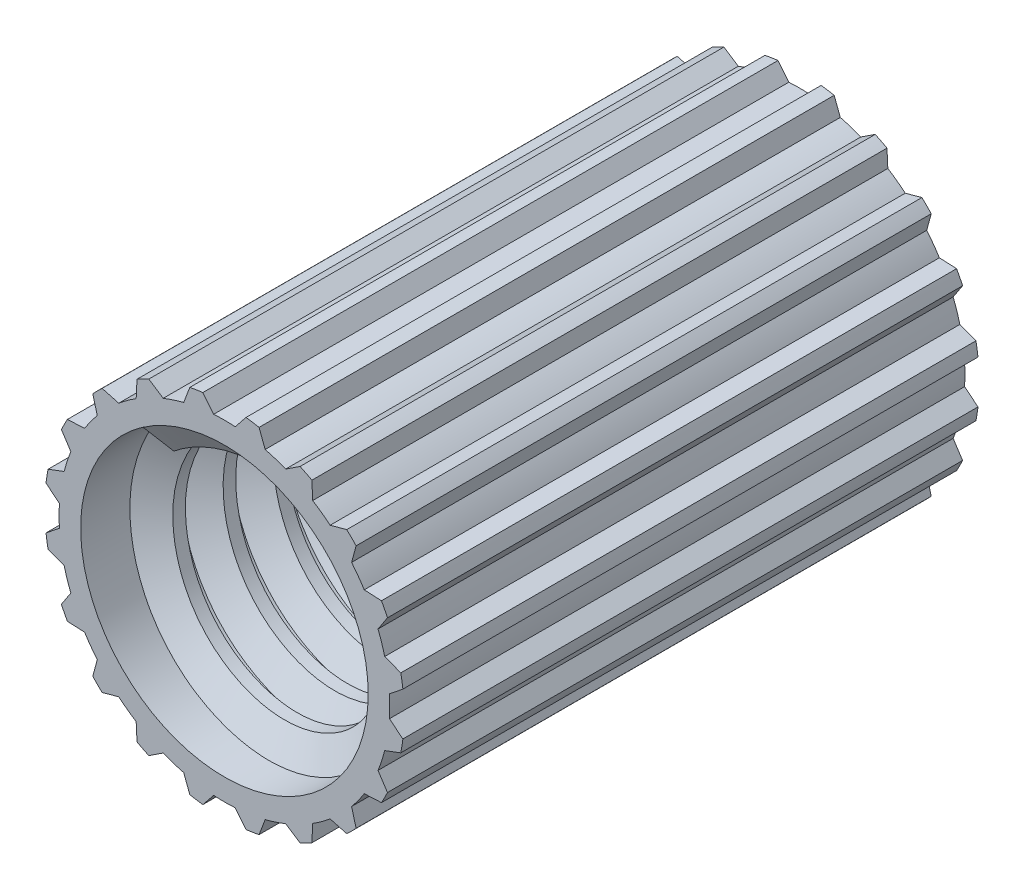
from build123d import *

# Parameters (mm, degrees)
BODYS_R                = 2.5
BODY_DEPTH             = 4
ENGAGEMENTCUT_DEPTH    = 6.338539126
ECCP_COUNT             = 20
MAJORDIAMETERCUTS_R    = 2
MAJORDIAMETERCUT_DEPTH = 9.736131867
THREAD1_PITCH          = 0.7


with BuildPart() as part:
    # BodyS → Body (new, symmetric)
    with BuildSketch(Plane(origin=(0, 0, 0), x_dir=(-1, 0, 0), z_dir=(0, 0, -1))):
        Circle(BODYS_R)
    extrude(amount=BODY_DEPTH, both=True)

    # EngagementCutS → EngagementCut (cut, symmetric)
    with BuildSketch(Plane(origin=(0, 0, 0), x_dir=(-1, 0, 0), z_dir=(0, 0, -1))):
        with BuildLine():
            Line((0.3, 2.481934729), (0.15, 2.295103484))
            ThreePointArc((0.15, 2.295103484), (0, 2.3), (-0.15, 2.295103484))
            Line((-0.15, 2.295103484), (-0.3, 2.481934729))
            ThreePointArc((-0.3, 2.481934729), (0, 2.5), (0.3, 2.481934729))
        make_face()
    engagementcut = extrude(amount=ENGAGEMENTCUT_DEPTH, both=True, mode=Mode.SUBTRACT)

    # ECCP: EngagementCut ×20 about axis
    eccp_axis = Axis((0, 0, 0), (0, 0, 1))
    for i in range(1, ECCP_COUNT):
        add(engagementcut.rotate(eccp_axis, i * 360 / ECCP_COUNT), mode=Mode.SUBTRACT)

    # MajorDiameterCutS → MajorDiameterCut (cut, through all)
    with BuildSketch(Plane.XY.offset(4)):
        Circle(MAJORDIAMETERCUTS_R)
    extrude(amount=-MAJORDIAMETERCUT_DEPTH, mode=Mode.SUBTRACT)

    # Thread1: the profile of Thread Profile1 profile screwed along a right-hand helix of 10.357143 turns, 6 arcs to a turn; built about Z, then put on its axis
    thread1_z = Axis((0, 0, 0), (0, 0, 1))
    thread1_corners = [(2.0003, 0, -0.000173205), (2.0003, 0, 0.612673203), (1.621113887, 0, 0.393749999), (1.621113887, 0, 0.218749999)]
    with BuildLine(mode=Mode.PRIVATE) as thread1_profile:
        Line(thread1_corners[0], thread1_corners[1])
        Line(thread1_corners[1], thread1_corners[2])
        Line(thread1_corners[2], thread1_corners[3])
        Line(thread1_corners[3], thread1_corners[0])
    thread1_cap = Face(thread1_profile.wire())
    thread1_turn_angles = [0, 30, 60, 90, 120, 150, 180, 210, 240, 270, 300, 330, 360]
    thread1_turn_weights = [1, 0.8660254037844387, 1, 0.8660254037844387, 1, 0.8660254037844387, 1, 0.8660254037844387, 1, 0.8660254037844387, 1, 0.8660254037844387, 1]
    thread1_turn_rails = [Edge.make_bspline([Vector(p[0], p[1], 0).rotate(thread1_z, thread1_turn_angles[k]) / thread1_turn_weights[k] + Vector(0, 0, p[2] + THREAD1_PITCH * thread1_turn_angles[k] / 360) for k in range(13)], [0, 0, 0, 1, 1, 2, 2, 3, 3, 4, 4, 5, 5, 6, 6, 6], 2, thread1_turn_weights) for p in thread1_corners]
    thread1_turn_sides = [Face.make_surface_from_curves(thread1_turn_rails[p[0]], thread1_turn_rails[p[1]]) for p in [(0, 1), (1, 2), (2, 3), (3, 0)]]
    thread1_last_angles = [3600, 3630, 3660, 3690, 3720, 3724.285714286, 3728.571428571]
    thread1_last_weights = [1, 0.8660254037844387, 1, 0.8660254037844387, 1, 0.9972037971811799, 1]
    thread1_last_rails = [Edge.make_bspline([Vector(p[0], p[1], 0).rotate(thread1_z, thread1_last_angles[k]) / thread1_last_weights[k] + Vector(0, 0, p[2] + THREAD1_PITCH * thread1_last_angles[k] / 360) for k in range(7)], [0, 0, 0, 1, 1, 2, 2, 3, 3, 3], 2, thread1_last_weights) for p in thread1_corners]
    thread1_last_sides = [Face.make_surface_from_curves(thread1_last_rails[p[0]], thread1_last_rails[p[1]]) for p in [(0, 1), (1, 2), (2, 3), (3, 0)]]
    thread1 = Plane(origin=(0, 0, -3.95), x_dir=(1, 0, 0), z_dir=(0, 0, 1)) * Solid(Shell([*[p.moved(Location((0, 0, THREAD1_PITCH * i))) for i in range(10) for p in thread1_turn_sides], *thread1_last_sides, thread1_cap, thread1_cap.rotate(thread1_z, 3728.571428571).moved(Location((0, 0, THREAD1_PITCH * 3728.571428571 / 360)))]))
    add(thread1)


solid = part.part
